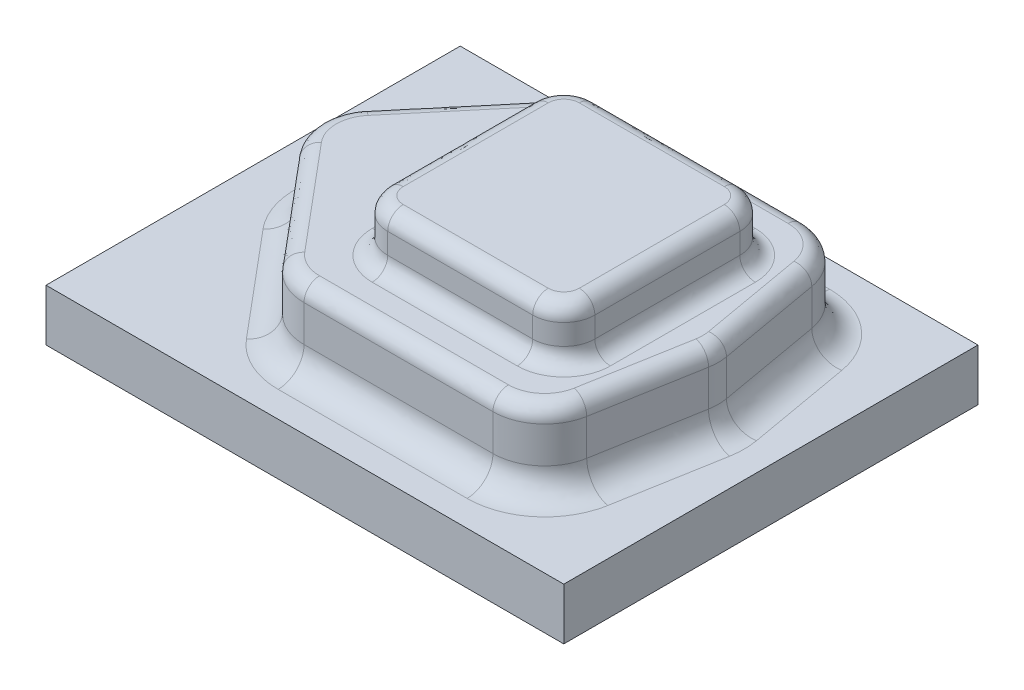
from build123d import *

# Parameters (mm, degrees)
SKETCH_2_W      = 100
SKETCH_2_H      = 80
EXTRUDE_1_DEPTH = 10
EXTRUDE_2_DEPTH = 15
SKETCH_4_W      = 40
SKETCH_4_H      = 40
EXTRUDE_3_DEPTH = 10
FILLET_9_R      = 10
FILLET_10_R     = 5
FILLET_11_R     = 3
FILLET_12_R     = 6
FILLET_13_R     = 3
FILLET_14_R     = 3


with BuildPart() as part:
    # 스케치2 → 보스-돌출1 (new body)
    with BuildSketch(Plane(origin=(0, 0, 0), x_dir=(1, 0, 0), z_dir=(0, 1, 0))):
        Rectangle(SKETCH_2_W, SKETCH_2_H)
    extrude(amount=EXTRUDE_1_DEPTH)

    # 스케치3 → 보스-돌출2 (add)
    with BuildSketch(Plane(origin=(0, 10, 0), x_dir=(1, 0, 0), z_dir=(0, 1, 0))):
        Polygon((-40, 0), (-14.827011065, 30), (34.710190579, 30), (40, 0), (34.710190579, -30), (-14.827011065, -30), align=None)
    extrude(amount=EXTRUDE_2_DEPTH)

    # 스케치4 → 보스-돌출3 (add)
    with BuildSketch(Plane(origin=(0, 25, 0), x_dir=(1, 0, 0), z_dir=(0, 1, 0))):
        with Locations((10, 0)):
            Rectangle(SKETCH_4_W, SKETCH_4_H)
    extrude(amount=EXTRUDE_3_DEPTH)

    # 다중 필렛9
    fillet_9_edges = [part.edges().sort_by_distance(p)[0] for p in [
        (34.710190579, 17.5, 30),
        (-14.827011065, 17.5, 30),
        (-40, 17.5, 0),
        (-14.827011065, 17.5, -30),
        (40, 17.5, 0),
        (34.710190579, 17.5, -30),
    ]]
    fillet(fillet_9_edges, radius=FILLET_9_R)

    # 다중 필렛10
    fillet_10_edges = [part.edges().sort_by_distance(p)[0] for p in [
        (-14.390117101, 10, 29.06307787),
        (8.077629892, 10, 30),
        (32.747070364, 10, 27.660444431),
        (37.930541604, 10, 11.736481777),
        (37.930541604, 10, -11.736481777),
        (32.747070364, 10, -27.660444431),
        (8.077629892, 10, -30),
        (-14.390117101, 10, -29.06307787),
        (-26.215375226, 10, -16.427876097),
        (-36.945927107, 10, 0),
        (-26.215375226, 10, 16.427876097),
    ]]
    fillet(fillet_10_edges, radius=FILLET_10_R)

    # 다중 필렛11
    fillet_11_edges = [part.edges().sort_by_distance(p)[0] for p in [
        (39.845733881, 25, 0),
        (37.930541604, 25, -11.736481777),
        (32.747070364, 25, -27.660444431),
        (8.077629892, 25, -30),
        (-14.390117101, 25, -29.06307787),
        (-26.215375226, 25, -16.427876097),
        (-36.945927107, 25, 0),
        (-26.215375226, 25, 16.427876097),
        (-14.390117101, 25, 29.06307787),
        (8.077629892, 25, 30),
        (32.747070364, 25, 27.660444431),
        (37.930541604, 25, 11.736481777),
    ]]
    fillet(fillet_11_edges, radius=FILLET_11_R)

    # 다중 필렛12
    fillet_12_edges = [part.edges().sort_by_distance(p)[0] for p in [
        (-10, 30, 20),
        (-10, 30, -20),
        (30, 30, -20),
        (30, 30, 20),
    ]]
    fillet(fillet_12_edges, radius=FILLET_12_R)

    # 다중 필렛13
    fillet_13_edges = [part.edges().sort_by_distance(p)[0] for p in [
        (28.242640687, 25, 18.242640687),
        (10, 25, 20),
        (-8.242640687, 25, 18.242640687),
        (-10, 25, 0),
        (-8.242640687, 25, -18.242640687),
        (10, 25, -20),
        (28.242640687, 25, -18.242640687),
        (30, 25, 0),
    ]]
    fillet(fillet_13_edges, radius=FILLET_13_R)

    # 다중 필렛14
    fillet_14_edges = [part.edges().sort_by_distance(p)[0] for p in [
        (-8.242640687, 35, -18.242640687),
        (-10, 35, 0),
        (-8.242640687, 35, 18.242640687),
        (10, 35, 20),
        (28.242640687, 35, 18.242640687),
        (30, 35, 0),
        (28.242640687, 35, -18.242640687),
        (10, 35, -20),
    ]]
    fillet(fillet_14_edges, radius=FILLET_14_R)


solid = part.part
